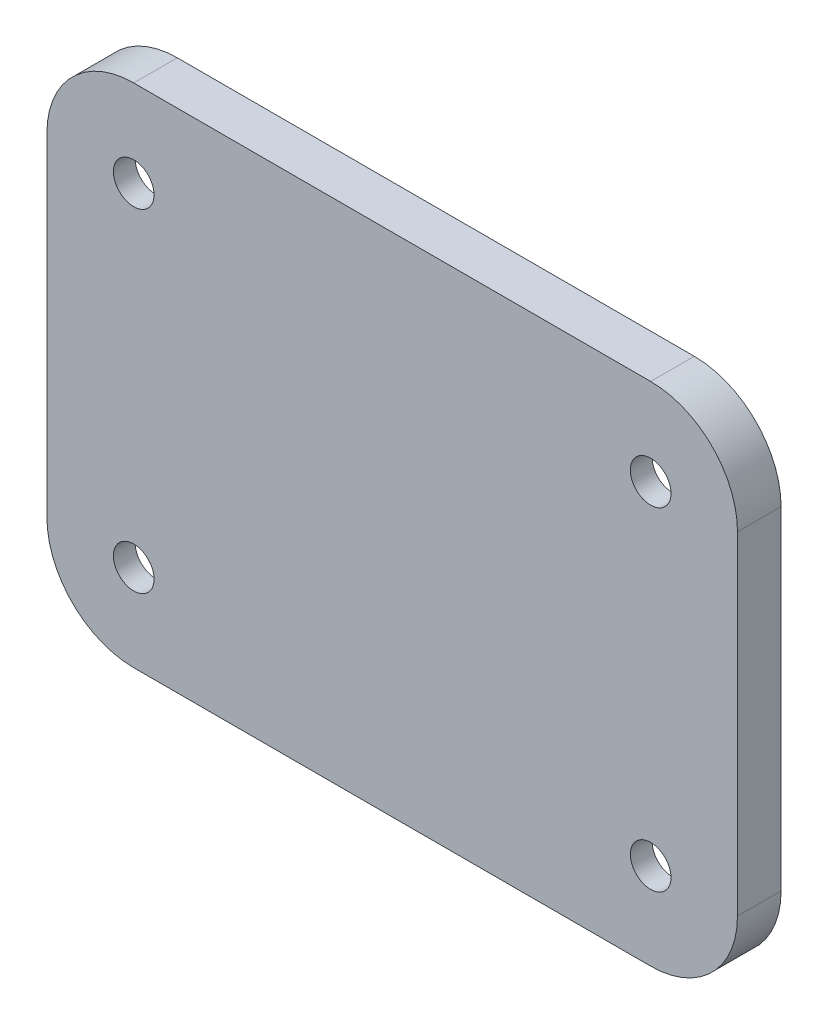
from build123d import *

# Parameters (mm, degrees)
SKETCH1_R           = 1.4
BOSS_EXTRUDE1_DEPTH = 1.5
BOSS_EXTRUDE2_START = 1.5
BOSS_EXTRUDE2_DEPTH = 1.5
CUT_EXTRUDE1_DEPTH  = 0.5


with BuildPart() as part:
    # Sketch1 → Boss-Extrude1 (new body)
    with BuildSketch(Plane.XY):
        with BuildLine():
            Line((-17.7875, -17.425), (17.7875, -17.425))
            ThreePointArc((17.7875, -17.425), (22.012463018, -15.674963018), (23.7625, -11.45))
            Line((23.7625, -11.45), (23.7625, 11.45))
            ThreePointArc((23.7625, 11.45), (22.012463018, 15.674963018), (17.7875, 17.425))
            Line((17.7875, 17.425), (-17.7875, 17.425))
            ThreePointArc((-17.7875, 17.425), (-22.012463018, 15.674963018), (-23.7625, 11.45))
            Line((-23.7625, 11.45), (-23.7625, -11.45))
            ThreePointArc((-23.7625, -11.45), (-22.012463018, -15.674963018), (-17.7875, -17.425))
        make_face()
        with Locations((-17.7875, -11.45)):
            Circle(SKETCH1_R, mode=Mode.SUBTRACT)
        with Locations((17.7875, -11.45)):
            Circle(SKETCH1_R, mode=Mode.SUBTRACT)
        with Locations((-17.7875, 11.45)):
            Circle(SKETCH1_R, mode=Mode.SUBTRACT)
        with Locations((17.7875, 11.45)):
            Circle(SKETCH1_R, mode=Mode.SUBTRACT)
    extrude(amount=BOSS_EXTRUDE1_DEPTH)

    # Sketch2 → Boss-Extrude2 (add)
    with BuildSketch(Plane(origin=(0, 0, 0), x_dir=(-1, 0, 0), z_dir=(0, 0, -1)).offset(BOSS_EXTRUDE2_START)):
        with BuildLine():
            Line((-17.7875, -17.425), (17.7875, -17.425))
            ThreePointArc((17.7875, -17.425), (22.012463018, -15.674963018), (23.7625, -11.45))
            Line((23.7625, -11.45), (23.7625, 11.45))
            ThreePointArc((23.7625, 11.45), (22.012463018, 15.674963018), (17.7875, 17.425))
            Line((17.7875, 17.425), (-17.7875, 17.425))
            ThreePointArc((-17.7875, 17.425), (-22.012463018, 15.674963018), (-23.7625, 11.45))
            Line((-23.7625, 11.45), (-23.7625, -11.45))
            ThreePointArc((-23.7625, -11.45), (-22.012463018, -15.674963018), (-17.7875, -17.425))
        make_face()
        with BuildLine():
            Line((17.7875, 15.925), (-17.7875, 15.925))
            ThreePointArc((-17.7875, 15.925), (-20.951802846, 14.614302846), (-22.2625, 11.45))
            Line((-22.2625, 11.45), (-22.2625, -11.45))
            ThreePointArc((-22.2625, -11.45), (-20.951802846, -14.614302846), (-17.7875, -15.925))
            Line((-17.7875, -15.925), (17.7875, -15.925))
            ThreePointArc((17.7875, -15.925), (20.951802846, -14.614302846), (22.2625, -11.45))
            Line((22.2625, -11.45), (22.2625, 11.45))
            ThreePointArc((22.2625, 11.45), (20.951802846, 14.614302846), (17.7875, 15.925))
        make_face(mode=Mode.SUBTRACT)
    extrude(amount=-BOSS_EXTRUDE2_DEPTH)

    # Sketch3 → Cut-Extrude1 (cut)
    with BuildSketch(Plane(origin=(0, 0, 0), x_dir=(-1, 0, 0), z_dir=(0, 0, -1))):
        with BuildLine():
            Line((17.7875, -6.975), (22.2625, -6.975))
            Line((22.2625, -6.975), (22.2625, 6.975))
            Line((22.2625, 6.975), (17.7875, 6.975))
            ThreePointArc((17.7875, 6.975), (14.623197154, 8.285697154), (13.3125, 11.45))
            Line((13.3125, 11.45), (13.3125, 15.925))
            Line((13.3125, 15.925), (-13.3125, 15.925))
            Line((-13.3125, 15.925), (-13.3125, 11.45))
            ThreePointArc((-13.3125, 11.45), (-14.623197154, 8.285697154), (-17.7875, 6.975))
            Line((-17.7875, 6.975), (-22.2625, 6.975))
            Line((-22.2625, 6.975), (-22.2625, -6.975))
            Line((-22.2625, -6.975), (-13.3125, -6.975))
            Line((-13.3125, -6.975), (-13.3125, -15.925))
            Line((-13.3125, -15.925), (13.3125, -15.925))
            Line((13.3125, -15.925), (13.3125, -11.45))
            ThreePointArc((13.3125, -11.45), (14.623197154, -8.285697154), (17.7875, -6.975))
        make_face()
    extrude(amount=-CUT_EXTRUDE1_DEPTH, mode=Mode.SUBTRACT)


solid = part.part
